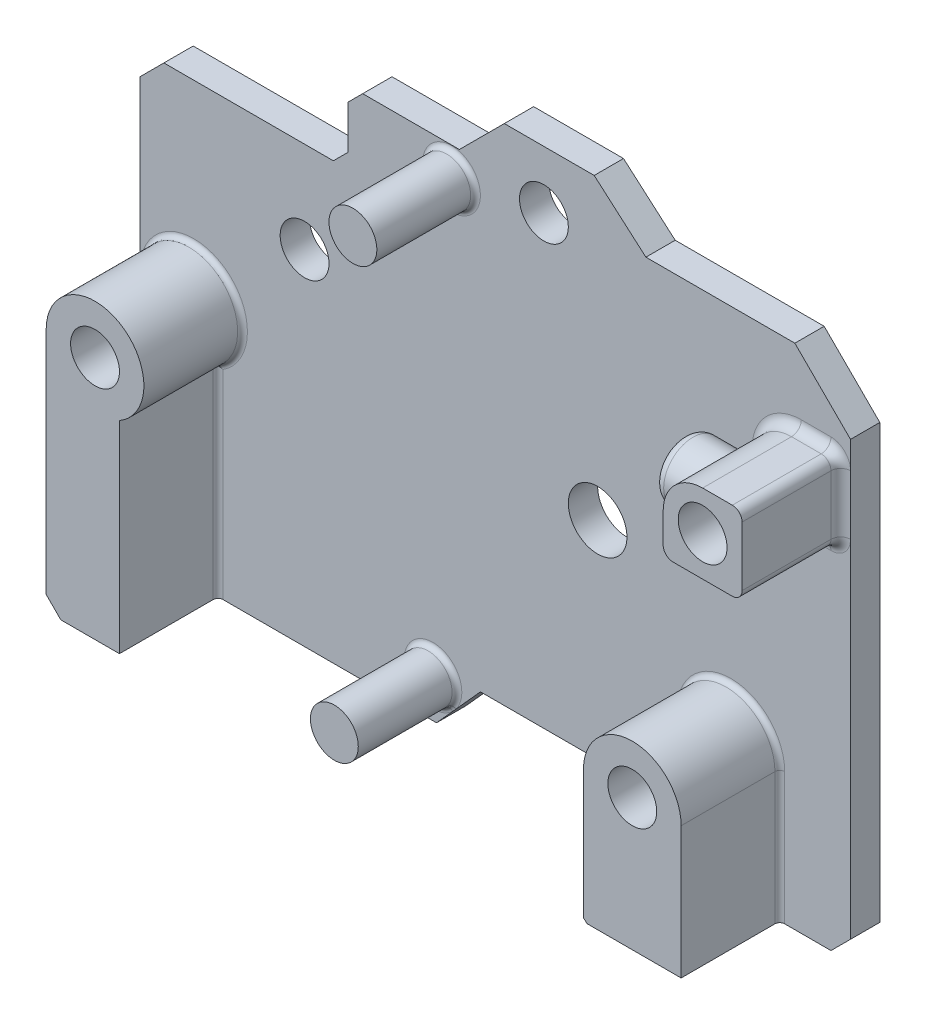
from build123d import *

# Parameters (mm, degrees)
SKETCH_1_R                      = 2.5
SKETCH_1_R_2                    = 3
EXTRUDE_1_DEPTH                 = 3
SKETCH_2_R                      = 2.45
SKETCH_2_R_2                    = 2.5
EXTRUDE_3_DEPTH                 = 10.1
CUT_EXTRUDE_START               = -3
CUT_EXTRUDE_1_OUTLINE_R         = 2.5
CUT_EXTRUDE_1_DEPTH             = 3
FILLET_1_R                      = 0.5
EXTRUDE_4_DEPTH                 = 10.1
SKETCH_4_R                      = 3
EXTRUDE_5_DEPTH                 = 3
FILLET_2_R                      = 1
FILLET_4_R                      = 1
SKETCH_5_R                      = 2.5
CUT_EXTRUDE_2_DEPTH             = 15
CHAMFER_1_SIZE                  = 1
CUT_EXTRUDE_3_REACH             = 53.995
CUT_EXTRUDE_3_DIRECTION_2_DEPTH = 52.994579065
CHAMFER_2_SIZE                  = 1.5
CUT_EXTRUDE_5_REACH             = 53.995
CHAMFER_3_SIZE                  = 2
HOLE_WIZARD_M5_2_D              = 4.2
HOLE_WIZARD_M5_2_DEPTH          = 10
HOLE_WIZARD_M5_2_TIP            = 1.2618073


# Read off the part's stored shape, not the designer's step: 컷-돌출1
with BuildPart() as part:
    # 스케치1 → 보스-돌출1 (new body)
    with BuildSketch(Plane.XY):
        Polygon((-6.675534975, -27.705928987), (-2.173514753, -22.705928987), (13.286485247, -22.705928987), (18.839547821, -27.705928987), (41.669547821, -27.705928987), (41.669547821, 12.674071013), (30.011242494, 24.294071013), (14.761242494, 24.294071013), (9.469547821, 28.894071013), (0.269547821, 28.894071013), (-4.330452179, 24.294071013), (-27.130452179, 24.294071013), (-42.030452179, 9.394071013), (-42.030452179, -27.705928987), align=None)
        with Locations((-20.178757506, 7.504071013)):
            Circle(SKETCH_1_R, mode=Mode.SUBTRACT)
        with Locations((4.321242494, 23.004071013)):
            Circle(SKETCH_1_R, mode=Mode.SUBTRACT)
        with Locations((9.821242494, -1.495928987)):
            Circle(SKETCH_1_R_2, mode=Mode.SUBTRACT)
    extrude(amount=EXTRUDE_1_DEPTH)

    # 스케치2 → 보스-돌출3 (add)
    # profile 1 of 4: a face of its own
    with BuildSketch(Plane.XY.offset(3)):
        with Locations(Location((-5.130452179, 21.294071013, 0), (0, 0, 180))):
            Circle(SKETCH_2_R)
    # profile 2 of 4: a face of its own
    with BuildSketch(Plane.XY.offset(3)):
        with Locations(Location((-7.030452179, -23.705928987, 0), (0, 0, 180))):
            Circle(SKETCH_2_R)
    # profile 3 of 4: a face of its own
    with BuildSketch(Plane.XY.offset(3)):
        with BuildLine():
            Line((18.469547821, -14.205928987), (18.469547821, -27.37277949))
            Line((18.469547821, -27.37277949), (18.839547821, -27.705928987))
            Line((18.839547821, -27.705928987), (28.469547821, -27.705928987))
            Line((28.469547821, -27.705928987), (28.469547821, -14.205928987))
            ThreePointArc((28.469547821, -14.205928987), (23.469547821, -9.205928987), (18.469547821, -14.205928987))
        make_face()
        with Locations((23.469547821, -14.205928987)):
            Circle(SKETCH_2_R_2, mode=Mode.SUBTRACT)
    # profile 4 of 4: a face of its own
    with BuildSketch(Plane.XY.offset(3)):
        with BuildLine():
            Line((-36.530452179, -2.705928987), (-36.530452179, -27.705928987))
            Line((-36.530452179, -27.705928987), (-29.030452179, -27.705928987))
            Line((-29.030452179, -27.705928987), (-29.030452179, -7.036056006))
            ThreePointArc((-29.030452179, -7.036056006), (-29.030452179, 1.624198032), (-36.530452179, -2.705928987))
        make_face()
        with Locations((-31.530452179, -2.705928987)):
            Circle(SKETCH_2_R_2, mode=Mode.SUBTRACT)
    extrude(amount=EXTRUDE_3_DEPTH)

    # 컷-돌출1 outline → 컷-돌출1 (cut)
    with BuildSketch(Plane.XY.offset(3).offset(CUT_EXTRUDE_START)):
        with Locations((-31.530452179, -2.705928987)):
            Circle(CUT_EXTRUDE_1_OUTLINE_R)
        with Locations((23.469547821, -14.205928987)):
            Circle(CUT_EXTRUDE_1_OUTLINE_R)
    extrude(amount=CUT_EXTRUDE_1_DEPTH, mode=Mode.SUBTRACT)

    # 필렛1
    fillet_1_edges = [part.edges().sort_by_distance(p)[0] for p in [
        (23.469547821, -9.205928987, 3),
        (-2.680452179, 21.294071013, 3),
        (-4.580452179, -23.705928987, 3),
        (28.469547821, -20.955928987, 3),
        (18.469547821, -20.789354238, 3),
        (-36.530452179, -15.205928987, 3),
        (-29.030452179, -17.370992496, 3),
        (-29.030452179, 1.624198032, 3),
    ]]
    fillet(fillet_1_edges, radius=FILLET_1_R)

    # 스케치3 → 보스-돌출4 (add)
    with BuildSketch(Plane.XY.offset(3)):
        with BuildLine():
            Line((27.631077151, 8.755600344), (33.70801849, 8.755600344))
            ThreePointArc((33.70801849, 8.755600344), (34.415125271, 9.048493563), (34.70801849, 9.755600344))
            Line((34.70801849, 9.755600344), (34.70801849, 15.832541683))
            ThreePointArc((34.70801849, 15.832541683), (34.415125271, 16.539648464), (33.70801849, 16.832541683))
            Line((33.70801849, 16.832541683), (30.669547821, 16.832541683))
            ThreePointArc((30.669547821, 16.832541683), (27.813917825, 15.649701009), (26.631077151, 12.794071013))
            Line((26.631077151, 12.794071013), (26.631077151, 9.755600344))
            ThreePointArc((26.631077151, 9.755600344), (26.92397037, 9.048493563), (27.631077151, 8.755600344))
        make_face()
    extrude(amount=EXTRUDE_4_DEPTH)

    # 스케치4 → 보스-돌출5 (add, symmetric)
    with BuildSketch(Plane.ZY.offset(-26.631077151)):
        with Locations((8.05, 12.794071013)):
            Circle(SKETCH_4_R)
    extrude(amount=EXTRUDE_5_DEPTH, both=True)

    # 필렛2
    fillet_2_edges = [part.edges().sort_by_distance(p)[0] for p in [
        (23.631077151, 12.794071013, 5.05),
    ]]
    fillet(fillet_2_edges, radius=FILLET_2_R)

    # 필렛4
    fillet_4_edges = [part.edges().sort_by_distance(p)[0] for p in [
        (32.188783155, 16.832541683, 3),
        (27.813917825, 15.649701009, 3),
        (30.669547821, 8.755600344, 3),
        (34.415125271, 9.048493563, 3),
        (34.70801849, 12.794071013, 3),
        (34.415125271, 16.539648464, 3),
        (26.92397037, 9.048493563, 3),
        (26.631077151, 11.274835679, 3),
    ]]
    fillet(fillet_4_edges, radius=FILLET_4_R)

    # 스케치5 → 컷-돌출2 (cut, symmetric)
    with BuildSketch(Plane.XY.offset(3)):
        with Locations((30.669547821, 12.794071013)):
            Circle(SKETCH_5_R)
    extrude(amount=CUT_EXTRUDE_2_DEPTH, both=True, mode=Mode.SUBTRACT)

    # 모따기1
    chamfer_1_edges = [part.edges().sort_by_distance(p)[0] for p in [
        (41.669547821, -27.705928987, 1.5),
        (-42.030452179, -27.705928987, 1.5),
    ]]
    chamfer(chamfer_1_edges, length=CHAMFER_1_SIZE)

    # 스케치8 → 컷-돌출3 (cut, up to next)
    with BuildSketch(Plane.XY.offset(3), mode=Mode.PRIVATE) as cut_extrude_3_sk1:
        Polygon((-15.730452179, 24.294071013), (-15.730452179, 16.844071013), (-34.580452179, 16.844071013), (-27.130452179, 24.294071013), align=None)
    cut_extrude_3_tool1 = extrude(cut_extrude_3_sk1.sketch, amount=-CUT_EXTRUDE_3_REACH, mode=Mode.PRIVATE) & part.part
    add(cut_extrude_3_tool1.solids().sort_by_distance((-23.445852, 20.263272, 3))[0], mode=Mode.SUBTRACT)

    # 스케치8 → 컷-돌출3 direction 2 (cut)
    with BuildSketch(Plane.XY.offset(3)):
        Polygon((-15.730452179, 24.294071013), (-15.730452179, 16.844071013), (-34.580452179, 16.844071013), (-27.130452179, 24.294071013), align=None)
    extrude(amount=CUT_EXTRUDE_3_DIRECTION_2_DEPTH, mode=Mode.SUBTRACT)

    # 모따기2
    chamfer_2_edges = [part.edges().sort_by_distance(p)[0] for p in [
        (-15.730452179, 16.844071013, 1.5),
        (-15.730452179, 24.294071013, 1.5),
    ]]
    chamfer(chamfer_2_edges, length=CHAMFER_2_SIZE)

    # 스케치10 → 컷-돌출5 (cut, up to next)
    with BuildSketch(Plane.XY.offset(3), mode=Mode.PRIVATE) as cut_extrude_5_sk1:
        Polygon((35.708018491, 18.616012734), (35.708018491, -27.705928987), (40.669547821, -27.705928987), (41.669547821, -26.705928987), (41.669547821, 12.674071013), align=None)
    cut_extrude_5_tool1 = extrude(cut_extrude_5_sk1.sketch, amount=-CUT_EXTRUDE_5_REACH, mode=Mode.PRIVATE) & part.part
    # 스케치10 → 컷-돌출5 (cut, up to next)
    with BuildSketch(Plane.XY.offset(3), mode=Mode.PRIVATE) as cut_extrude_5_sk2:
        Polygon((-37.030452179, -2.705928987), (-37.030452179, 14.394071013), (-42.030452179, 9.394071013), (-42.030452179, -26.705928987), (-41.030452179, -27.705928987), (-37.030452179, -27.705928987), align=None)
    cut_extrude_5_tool2 = extrude(cut_extrude_5_sk2.sketch, amount=-CUT_EXTRUDE_5_REACH, mode=Mode.PRIVATE) & part.part
    add(cut_extrude_5_tool1.solids().sort_by_distance((38.615426, -5.955072, 3))[0], mode=Mode.SUBTRACT)
    add(cut_extrude_5_tool2.solids().sort_by_distance((-39.472224, -7.830275, 3))[0], mode=Mode.SUBTRACT)

    # 모따기3
    chamfer_3_edges = [part.edges().sort_by_distance(p)[0] for p in [
        (-37.030452179, -27.705928987, 1.5),
        (35.708018491, -27.705928987, 1.5),
    ]]
    chamfer(chamfer_3_edges, length=CHAMFER_3_SIZE)

    # M5 나사 구멍2
    with Locations(Plane(origin=(23.469547821, -27.705928987, 8.05), x_dir=(0, 0, -1), z_dir=(0, -1, 0))):
        with Locations((0, 0), (0, -56.25)):
            Hole(HOLE_WIZARD_M5_2_D / 2, depth=HOLE_WIZARD_M5_2_DEPTH)
            with Locations((0, 0, -(HOLE_WIZARD_M5_2_DEPTH + HOLE_WIZARD_M5_2_TIP / 2))):  # 118° drill point
                Cone(0, HOLE_WIZARD_M5_2_D / 2, HOLE_WIZARD_M5_2_TIP, mode=Mode.SUBTRACT)


solid = part.part
